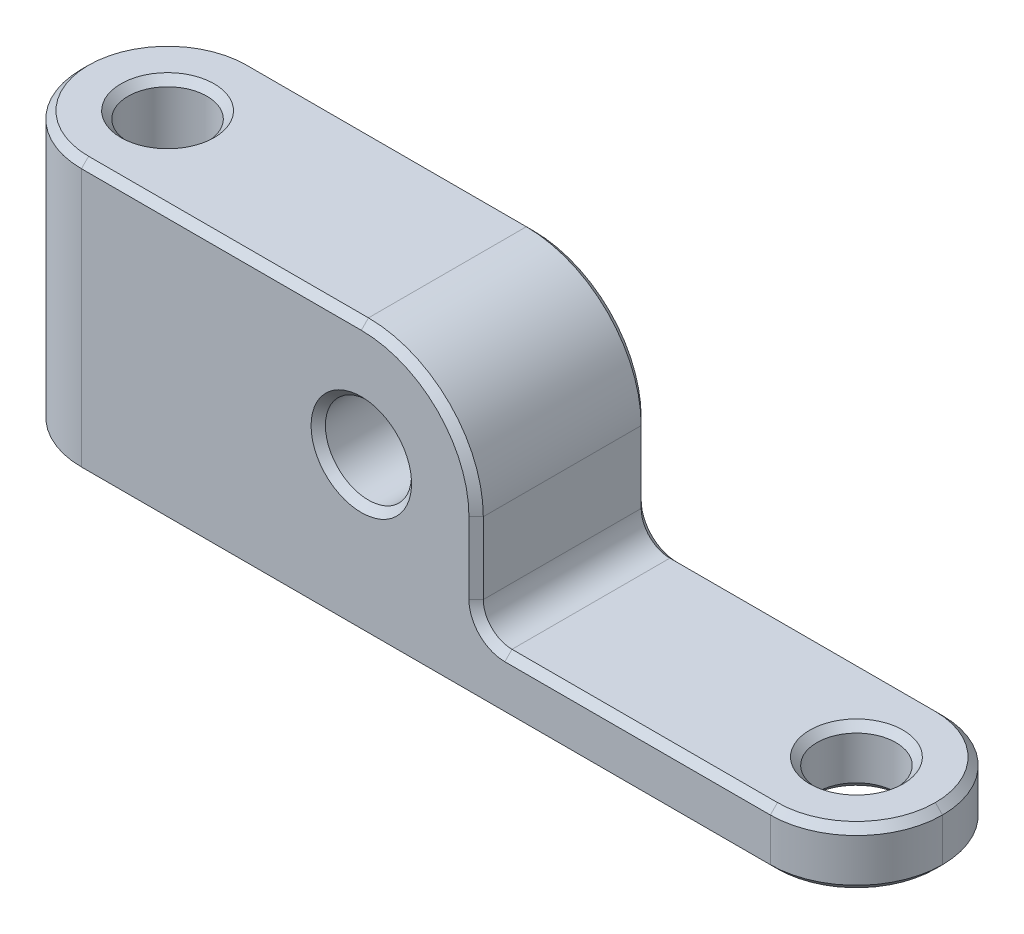
from build123d import *

# Parameters (mm, degrees)
SKETCH1_R               = 2.38125
BOSS_EXTRUDE1_DEPTH     = 9.525
CUT_EXTRUDE1_DEPTH      = 51.855779923
CUT_EXTRUDE1_DEPTH_BACK = 51.855779923
SKETCH2_R               = 2.1828125
FILLET1_R               = 4.7625
CHAMFER1_SIZE           = 0.396875


with BuildPart() as part:
    # Sketch1 → Boss-Extrude1 (new body)
    with BuildSketch(Plane.XY):
        with BuildLine():
            Line((0, 0), (0, 15.08125))
            Line((0, 15.08125), (20.240625, 15.08125))
            ThreePointArc((20.240625, 15.08125), (24.730753061, 13.221378061), (26.590625, 8.73125))
            Line((26.590625, 8.73125), (26.590625, 4.7625))
            ThreePointArc((26.590625, 4.7625), (27.055592985, 3.639967985), (28.178125, 3.175))
            Line((28.178125, 3.175), (47.625, 3.175))
            Line((47.625, 3.175), (47.625, 0))
            Line((47.625, 0), (0, 0))
        make_face()
        with Locations(Location((20.240625, 8.73125, 0), (0, 0, 180))):
            Circle(SKETCH1_R, mode=Mode.SUBTRACT)
    extrude(amount=BOSS_EXTRUDE1_DEPTH)

    # Sketch2 → Cut-Extrude1 (cut, two sides: drawn at the far end of the back side and taken through both)
    with BuildSketch(Plane(origin=(0, 15.08125, 0), x_dir=(1, 0, 0), z_dir=(0, 1, 0)).offset(-CUT_EXTRUDE1_DEPTH_BACK)):
        with Locations(Location((4.7625, -4.7625, 0), (0, 0, 270))):
            Circle(SKETCH2_R)
        with Locations(Location((42.8625, -4.7625, 0), (0, 0, 270))):
            Circle(SKETCH2_R)
    extrude(amount=CUT_EXTRUDE1_DEPTH + CUT_EXTRUDE1_DEPTH_BACK, mode=Mode.SUBTRACT)

    # Fillet1
    fillet1_edges = [part.edges().sort_by_distance(p)[0] for p in [
        (47.625, 1.5875, 9.525),
        (47.625, 1.5875, 0),
        (0, 7.540625, 0),
        (0, 7.540625, 9.525),
    ]]
    fillet(fillet1_edges, radius=FILLET1_R - 0.0001)  # a hair under: the kernel refuses the full size

    # Chamfer1
    chamfer1_edges = [part.edges().sort_by_distance(p)[0] for p in [
        (27.055592985, 3.639967985, 0),
        (27.055592985, 3.639967985, 9.525),
        (26.590625, 6.746875, 9.525),
        (22.621875, 8.73125, 0),
        (22.621875, 8.73125, 9.525),
        (24.730753061, 13.221378061, 9.525),
        (12.5015125, 15.08125, 9.525),
        (4.7625, 0, 2.5796875),
        (4.7625, 15.08125, 2.5796875),
        (42.8625, 0, 2.5796875),
        (42.8625, 3.175, 2.5796875),
        (23.8125, 0, 9.525),
        (35.5203625, 3.175, 9.525),
        (35.5203625, 3.175, 0),
        (46.230125335, 3.175, 1.394874665),
        (46.230125335, 3.175, 8.130125335),
        (23.8125, 0, 0),
        (1.394874665, 0, 8.130125335),
        (1.394874665, 0, 1.394874665),
        (46.230125335, 0, 1.394874665),
        (46.230125335, 0, 8.130125335),
        (1.394874665, 15.08125, 8.130125335),
        (1.394874665, 15.08125, 1.394874665),
        (12.5015125, 15.08125, 0),
        (24.730753061, 13.221378061, 0),
        (26.590625, 6.746875, 0),
    ]]
    chamfer(chamfer1_edges, length=CHAMFER1_SIZE)


solid = part.part
